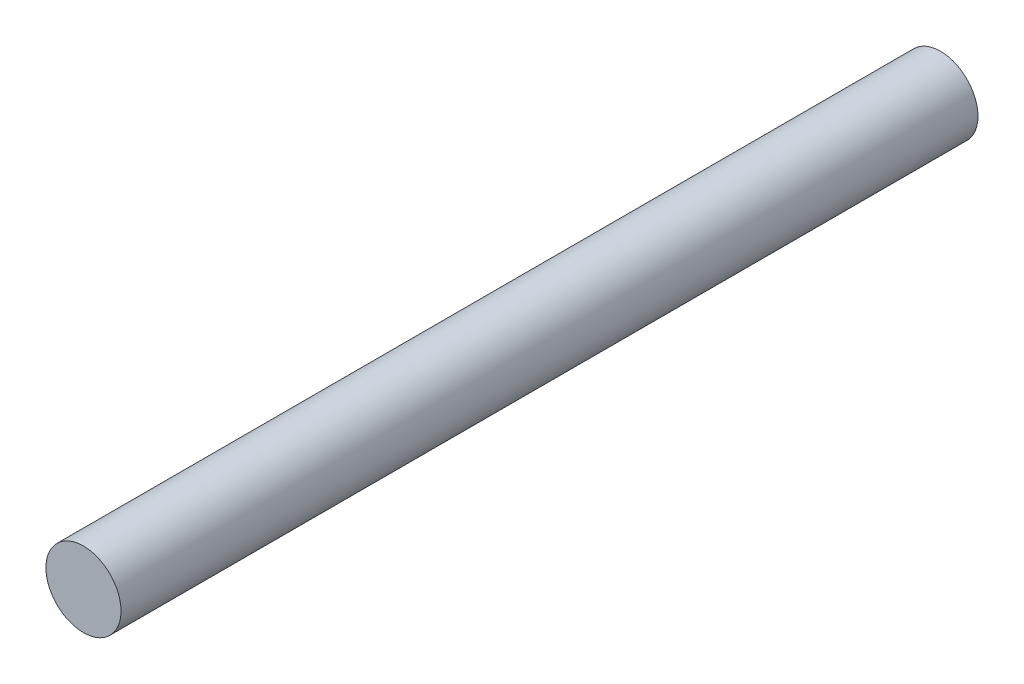
from build123d import *

# Parameters (mm, degrees)
SKETCH1_R           = 5.5626
BOSS_EXTRUDE1_DEPTH = 127


with BuildPart() as part:
    # Sketch1 → Boss-Extrude1 (new body)
    with BuildSketch(Plane.XY):
        Circle(SKETCH1_R)
    extrude(amount=BOSS_EXTRUDE1_DEPTH)


solid = part.part
